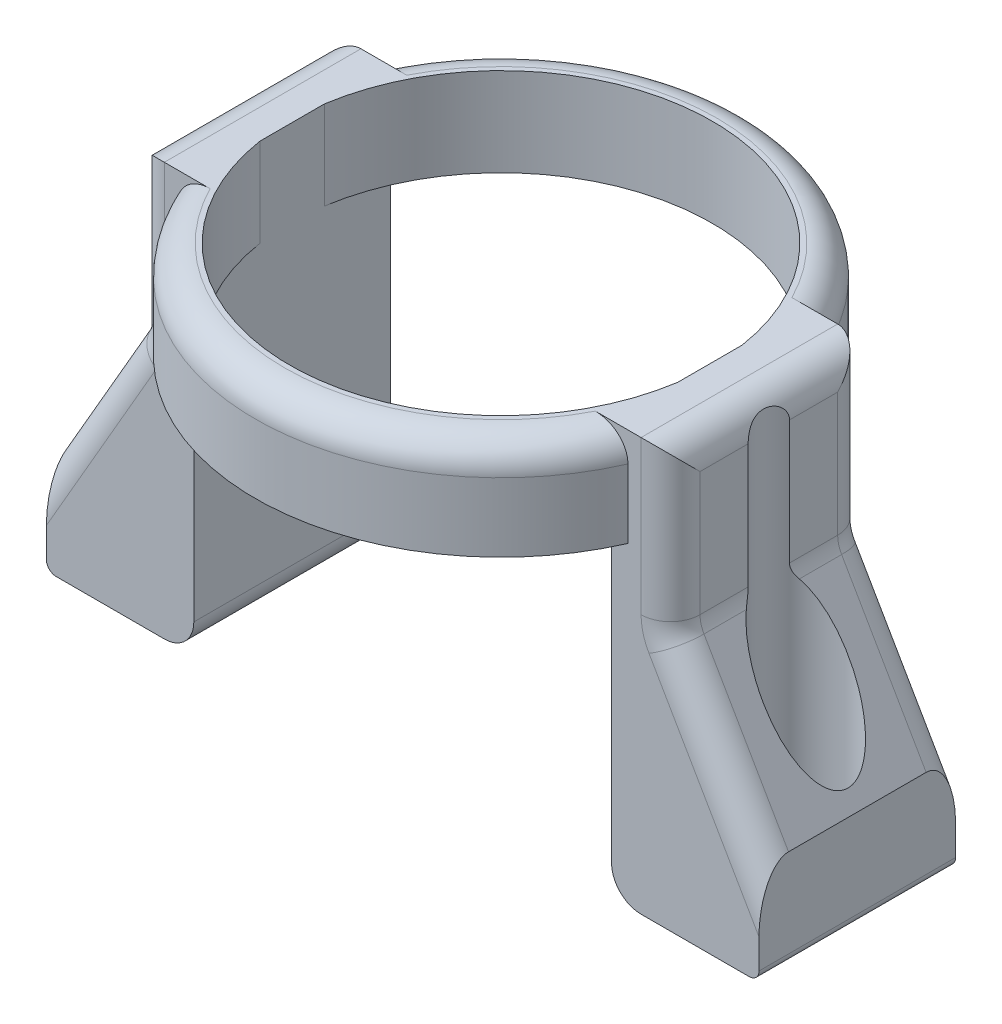
from build123d import *
from OCP.BRepFilletAPI import BRepFilletAPI_MakeChamfer

# Parameters (mm, degrees)
SKETCH_1_R          = 25
SKETCH_1_R_2        = 21.5
EXTRUDE_1_DEPTH     = 10
SKETCH_2_W          = 6
SKETCH_2_H          = 20
EXTRUDE_2_DEPTH     = 42
SKETCH_3_W          = 15
SKETCH_3_H          = 20
EXTRUDE_3_DEPTH     = 10
SKETCH_4_R          = 2.3
CUT_EXTRUDE_1_DEPTH = 61.852793691
CHAMFER_2_SIZE      = 15.588457268
CHAMFER_2_SIZE_2    = 9
FILLET_1_R          = 3
SKETCH_5_R          = 4.3
CUT_EXTRUDE_2_DEPTH = 37
CHAMFER_3_SIZE      = 1
CHAMFER_3_SIZE2     = 1.732050808
CHAMFER_4_SIZE      = 2
FILLET_2_R          = 1


# Some blends are built 0.0001 mm under size
with BuildPart() as part:
    # Эскиз1 → Бобышка-Вытянуть1 (new body)
    with BuildSketch(Plane(origin=(0, 0, 0), x_dir=(1, 0, 0), z_dir=(0, 1, 0))):
        with Locations(Location((0, 0, 0), (0, 0, 270))):
            Circle(SKETCH_1_R)
        with Locations(Location((0, 0, 0), (0, 0, 270))):
            Circle(SKETCH_1_R_2, mode=Mode.SUBTRACT)
    extrude(amount=EXTRUDE_1_DEPTH)

    # Эскиз2 → Бобышка-Вытянуть2 (add)
    with BuildSketch(Plane(origin=(0, 10, 0), x_dir=(-1, 0, 0), z_dir=(0, -1, 0))):
        with Locations((-24.25, 0)):
            Rectangle(SKETCH_2_W, SKETCH_2_H)
        with Locations((24.25, 0)):
            Rectangle(SKETCH_2_W, SKETCH_2_H)
    extrude(amount=EXTRUDE_2_DEPTH)

    # Эскиз3 → Бобышка-Вытянуть3 (add)
    with BuildSketch(Plane.XZ.offset(32)):
        with Locations((28.75, 0)):
            Rectangle(SKETCH_3_W, SKETCH_3_H)
        with Locations((-28.75, 0)):
            Rectangle(SKETCH_3_W, SKETCH_3_H)
    extrude(amount=-EXTRUDE_3_DEPTH)

    # Эскиз4 → Вырез-Вытянуть1 (cut, through all)
    with BuildSketch(Plane.XZ.offset(32)):
        with Locations(Location((31, 0, 0), (0, 0, 270))):
            Circle(SKETCH_4_R)
        with Locations(Location((-31, 0, 0), (0, 0, 270))):
            Circle(SKETCH_4_R)
    extrude(amount=-CUT_EXTRUDE_1_DEPTH, mode=Mode.SUBTRACT)

    # Фаска2
    # the kernel refuses this chamfer: 15.588457268, 9 mm, written as the material it adds along each edge
    with BuildSketch(Plane(origin=(27.25, -22, 10), x_dir=(-0.01932676561270058, 0.9998132206222079, 0), z_dir=(0, 0, -1))) as chamfer_2_piece_1_section:
        Polygon((CHAMFER_2_SIZE * 0.99981322063, CHAMFER_2_SIZE * 0.0193267656128), (-CHAMFER_2_SIZE_2 * 0.0193267656127, CHAMFER_2_SIZE_2 * 0.999813220622), (0, 0), align=None)
    chamfer_2_piece_1 = extrude(amount=20, mode=Mode.PRIVATE)
    chamfer_2_piece_1 = split(chamfer_2_piece_1, bisect_by=Plane(origin=(36.25, -8.615994123, -6.666666667), z_dir=(-1, 0, 0)), keep=Keep.TOP, mode=Mode.PRIVATE)
    chamfer_2_piece_1 = chamfer_2_piece_1 - Plane(origin=(31, -8.615994123, 0), x_dir=(0, 0, -1), z_dir=(0, -1, 0)) * Cylinder(2.3, 103, mode=Mode.PRIVATE)
    add(chamfer_2_piece_1)
    with BuildSketch(Plane(origin=(-27.25, -22, -10), x_dir=(-0.9983227437537927, -0.05789386240267132, 0), z_dir=(0, 0, 1))) as chamfer_2_piece_2_section:
        Polygon((CHAMFER_2_SIZE_2 * 0.998322743754, -CHAMFER_2_SIZE_2 * 0.0578938624027), (-CHAMFER_2_SIZE * 0.0578938624031, -CHAMFER_2_SIZE * 0.998322743761), (0, 0), align=None)
    chamfer_2_piece_2 = extrude(amount=20, mode=Mode.PRIVATE)
    chamfer_2_piece_2 = split(chamfer_2_piece_2, bisect_by=Plane(origin=(-36.25, -19.368298987, 6.666666667), z_dir=(1, 0, 0)), keep=Keep.TOP, mode=Mode.PRIVATE)
    chamfer_2_piece_2 = chamfer_2_piece_2 - Plane(origin=(-31, -19.368298987, 0), x_dir=(0, 0, -1), z_dir=(0, -1, 0)) * Cylinder(2.3, 103, mode=Mode.PRIVATE)
    add(chamfer_2_piece_2)

    # Скругление1
    fillet_1_edges = [part.edges().sort_by_distance(p)[0] for p in [
        (27.25, 1.794228634, -10),
        (27.25, 1.794228634, 10),
        (27.25, -6.411542732, 0),
        (-27.25, 1.794228634, -10),
        (-27.25, 1.794228634, 10),
        (-27.25, -6.411542732, 0),
        (31.75, -14.205771366, 10),
        (31.75, -14.205771366, -10),
        (-31.75, -14.205771366, 10),
        (0, 10, -25),
        (-31.75, -14.205771366, -10),
        (27.25, 10, 0),
        (21.25, -32, 0),
        (0, 10, 25),
        (-27.25, 10, 0),
        (-21.25, -32, 0),
    ]]
    fillet(fillet_1_edges, radius=FILLET_1_R)

    # Эскиз5 → Вырез-Вытянуть2 (cut)
    with BuildSketch(Plane(origin=(0, 10, 0), x_dir=(1, 0, 0), z_dir=(0, 1, 0))):
        with Locations(Location((31, 0, 0), (0, 0, 270))):
            Circle(SKETCH_5_R)
        with Locations(Location((-31, 0, 0), (0, 0, 321.134589702))):
            Circle(SKETCH_5_R)
    extrude(amount=-CUT_EXTRUDE_2_DEPTH, mode=Mode.SUBTRACT)

    # Фаска3: one chamfer whose edges measure the first distance from different faces: ONE call of the kernel's chamfer builder (chamfer() names one face for all edges)
    chamfer_3_edges_1 = [part.edges().sort_by_distance(p)[0] for p in [
        (0, 0, -21.5),
    ]]
    chamfer_3_side_1 = [part.faces().sort_by_distance(p)[0] for p in [
        (0, 5, -21.5),
    ]]
    chamfer_3_edges_2 = [part.edges().sort_by_distance(p)[0] for p in [
        (0, 0, 21.5),
    ]]
    chamfer_3_side_2 = [part.faces().sort_by_distance(p)[0] for p in [
        (0, 5, 21.5),
    ]]
    chamfer_3 = BRepFilletAPI_MakeChamfer(part.part.solid().wrapped)
    for e in chamfer_3_edges_1:
        chamfer_3.Add(CHAMFER_3_SIZE, CHAMFER_3_SIZE2, e.wrapped, chamfer_3_side_1[0].wrapped)  # the first distance lies on this face
    for e in chamfer_3_edges_2:
        chamfer_3.Add(CHAMFER_3_SIZE, CHAMFER_3_SIZE2, e.wrapped, chamfer_3_side_2[0].wrapped)  # the first distance lies on this face
    add(Compound.cast(chamfer_3.Shape()), mode=Mode.REPLACE)

    # Фаска4
    chamfer_4_edges = [part.edges().sort_by_distance(p)[0] for p in [
        (31, -27, 2.3),
    ]]
    chamfer(chamfer_4_edges, length=CHAMFER_4_SIZE - 0.0001)  # a hair under: the kernel refuses the full size

    # Скругление2
    fillet_2_edges = [part.edges().sort_by_distance(p)[0] for p in [
        (36.25, -32, 0),
        (-36.25, -32, 0),
    ]]
    fillet(fillet_2_edges, radius=FILLET_2_R)


solid = part.part
